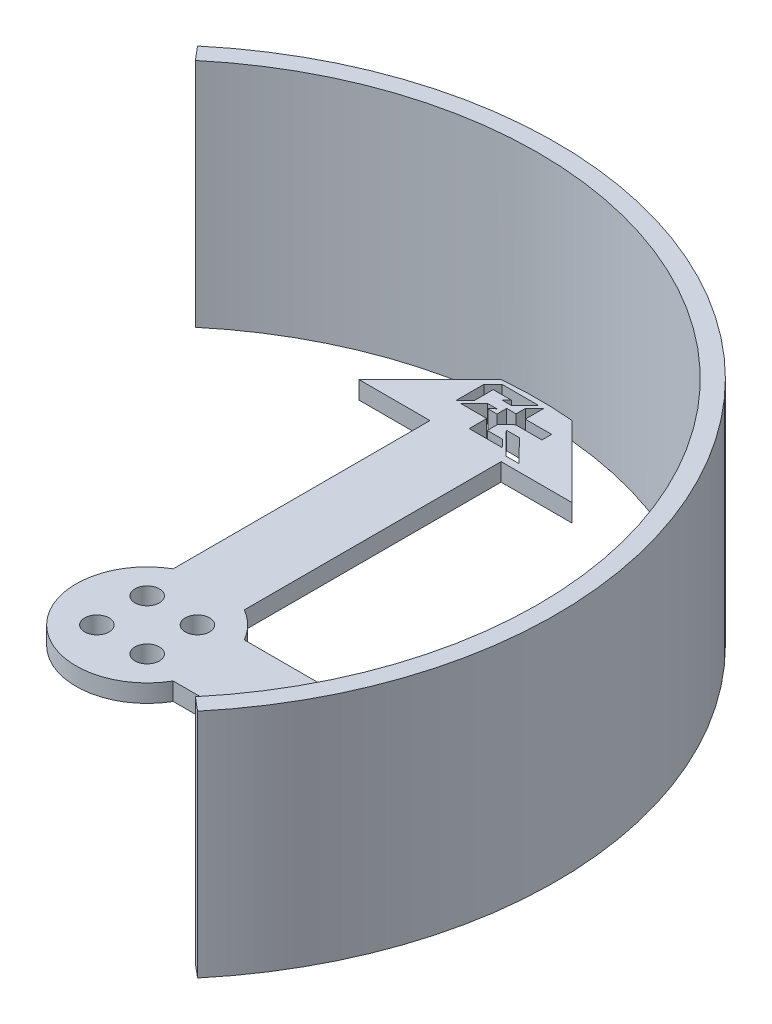
from build123d import *

# Parameters (mm, degrees)
BOSS_EXTRUDE1_DEPTH      = 3.175
BOSS_EXTRUDE4_DEPTH      = 38.1
BOSS_EXTRUDE4_DEPTH_BACK = 3.175
SKETCH3_R                = 12.7
BOSS_EXTRUDE5_DEPTH      = 3.175
SKETCH4_R                = 2.1828125
CUT_EXTRUDE1_DEPTH       = 111.076842478
BOSS_EXTRUDE6_DEPTH      = 3.175
CUT_EXTRUDE2_DEPTH       = 111.076842478


with BuildPart() as part:
    # Sketch1 → Boss-Extrude1 (new body)
    with BuildSketch(Plane(origin=(0, 0, 0), x_dir=(1, 0, 0), z_dir=(0, 1, 0))):
        Polygon((-6.35, 69.85), (-6.35, -6.35), (69.85, -6.35), (69.85, 6.35), (6.35, 6.35), (6.35, 69.85), align=None)
    extrude(amount=BOSS_EXTRUDE1_DEPTH)

    # Sketch2 → Boss-Extrude4 (add, two sides: drawn at the far end of the back side and taken through both)
    with BuildSketch(Plane(origin=(0, 3.175, 0), x_dir=(1, 0, 0), z_dir=(0, 1, 0)).offset(-BOSS_EXTRUDE4_DEPTH_BACK)):
        with BuildLine():
            Line((-46.939565197, 55.940395459), (-44.898714537, 53.508204352))
            ThreePointArc((-44.898714537, 53.508204352), (49.391408666, 49.391408666), (53.508204352, -44.898714537))
            Line((53.508204352, -44.898714537), (55.940395459, -46.939565197))
            ThreePointArc((55.940395459, -46.939565197), (51.636472696, 51.636472696), (-46.939565197, 55.940395459))
        make_face()
    extrude(amount=BOSS_EXTRUDE4_DEPTH + BOSS_EXTRUDE4_DEPTH_BACK)

    # Sketch3 → Boss-Extrude5 (add)
    with BuildSketch(Plane(origin=(0, 3.175, 0), x_dir=(1, 0, 0), z_dir=(0, 1, 0))):
        Circle(SKETCH3_R)
    extrude(amount=-BOSS_EXTRUDE5_DEPTH)

    # Sketch4 → Cut-Extrude1 (cut, through all)
    with BuildSketch(Plane(origin=(0, 3.175, 0), x_dir=(1, 0, 0), z_dir=(0, 1, 0))):
        with Locations((4.490128061, 4.490128061)):
            Circle(SKETCH4_R)
        with Locations((4.490128061, -4.490128061)):
            Circle(SKETCH4_R)
        with Locations((-4.490128061, -4.490128061)):
            Circle(SKETCH4_R)
        with Locations((-4.490128061, 4.490128061)):
            Circle(SKETCH4_R)
    extrude(amount=-CUT_EXTRUDE1_DEPTH, mode=Mode.SUBTRACT)

    # Sketch6 → Boss-Extrude6 (add)
    with BuildSketch(Plane(origin=(0, 3.175, 0), x_dir=(1, 0, 0), z_dir=(0, 1, 0))):
        Polygon((-6.35, 69.560764803), (6.35, 69.560764803), (19.05, 56.860764803), (-19.05, 56.860764803), align=None)
        Polygon((69.560764803, 6.35), (56.860764803, 19.05), (56.860764803, -19.05), (69.560764803, -6.35), align=None)
    extrude(amount=-BOSS_EXTRUDE6_DEPTH)

    # Sketch7 → Cut-Extrude2 (cut, through all)
    with BuildSketch(Plane(origin=(0, 3.175, 0), x_dir=(1, 0, 0), z_dir=(0, 1, 0))):
        Polygon((-7.133235586, 67.291819721), (-7.133235586, 62.249902476), (-5.48994404, 63.893194022), (-5.48994404, 67.291819721), (-2.203360947, 67.291819721), (-3.02500672, 66.470173948), (-1.381715173, 66.470173948), (1.045874611, 68.897763732), (-5.48994404, 68.897763732), align=None)
        Polygon((-6.311589813, 62.249902476), (-3.846652493, 64.658818493), (-2.203360947, 64.658818493), (-3.02500672, 63.855846487), (-1.381715173, 63.855846487), (-1.381715173, 65.592506872), (0.298923908, 65.592506872), (0.298923908, 67.291819721), (1.942215455, 68.897763732), (1.942215455, 65.592506872), (6.648004884, 65.592506872), (6.648004884, 63.855846487), (1.942215455, 63.855846487), (0.298923908, 62.249902476), (0.298923908, 60.454615147), (2.990552081, 60.454615147), (4.295110169, 59.119718498), (-1.605800384, 59.119718498), (-1.605800384, 62.249902476), align=None)
        Polygon((5.910802064, 58.151241346), (8.247051057, 58.151241346), (4.295110169, 62.195087835), (1.942215455, 62.195087835), align=None)
        Polygon((67.291819721, 7.133235586), (62.249902476, 7.133235586), (63.893194022, 5.48994404), (67.291819721, 5.48994404), (67.291819721, 2.203360947), (66.470173948, 3.02500672), (66.470173948, 1.381715173), (68.897763732, -1.045874611), (68.897763732, 5.48994404), align=None)
        Polygon((62.249902476, 6.311589813), (64.658818493, 3.846652493), (64.658818493, 2.203360947), (63.855846487, 3.02500672), (63.855846487, 1.381715173), (65.592506872, 1.381715173), (65.592506872, -0.298923908), (67.291819721, -0.298923908), (68.897763732, -1.942215455), (65.592506872, -1.942215455), (65.592506872, -6.648004884), (63.855846487, -6.648004884), (63.855846487, -1.942215455), (62.249902476, -0.298923908), (60.454615147, -0.298923908), (60.454615147, -2.990552081), (59.119718498, -4.295110169), (59.119718498, 1.605800384), (62.249902476, 1.605800384), align=None)
        Polygon((58.151241346, -5.910802064), (58.151241346, -8.247051057), (62.195087835, -4.295110169), (62.195087835, -1.942215455), align=None)
    extrude(amount=-CUT_EXTRUDE2_DEPTH, mode=Mode.SUBTRACT)


solid = part.part
